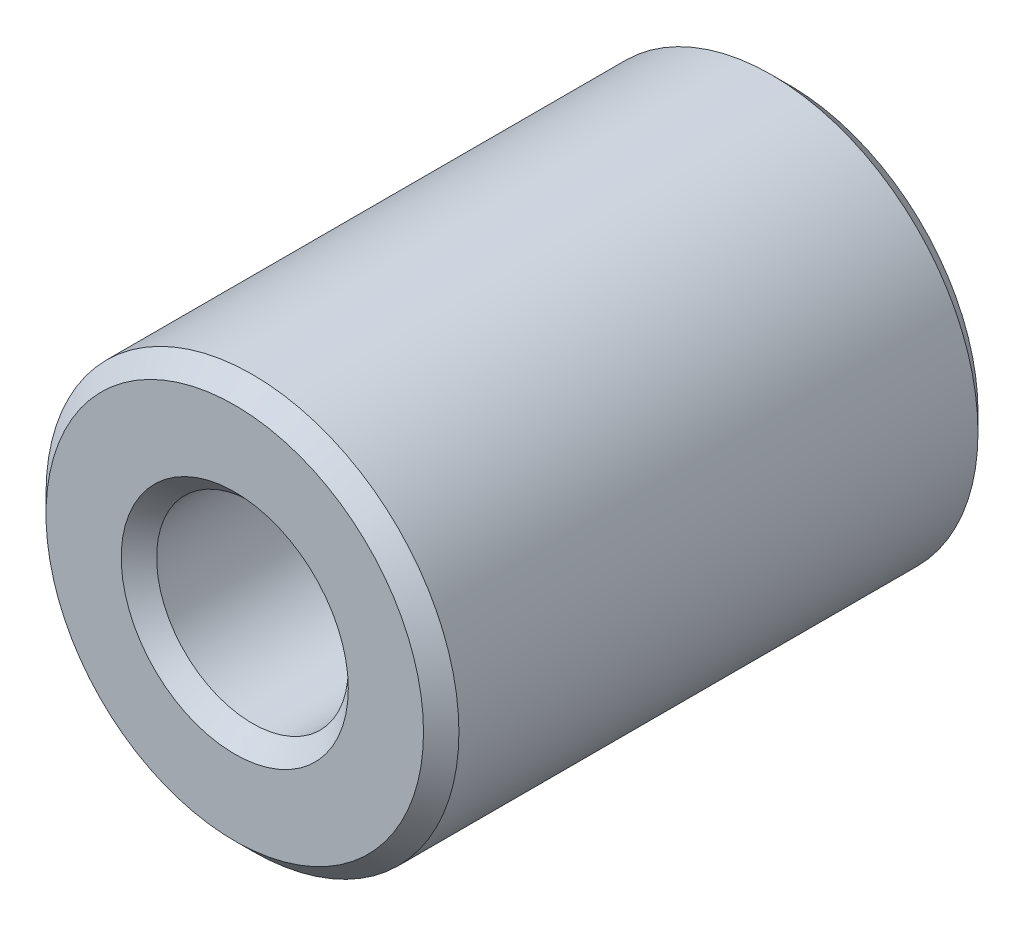
from build123d import *

# Parameters (mm, degrees)
SKETCH2_R           = 3.5
SKETCH2_R_2         = 1.625
BOSS_EXTRUDE1_DEPTH = 9.4
CHAMFER1_SIZE       = 0.3


with BuildPart() as part:
    # Sketch2 → Boss-Extrude1 (new body)
    with BuildSketch(Plane.XY):
        Circle(SKETCH2_R)
        Circle(SKETCH2_R_2, mode=Mode.SUBTRACT)
    extrude(amount=BOSS_EXTRUDE1_DEPTH)

    # Chamfer1
    chamfer1_edges = [part.edges().sort_by_distance(p)[0] for p in [
        (-3.5, 0, 0),
        (-3.5, 0, 9.4),
        (-1.625, 0, 0),
        (-1.625, 0, 9.4),
    ]]
    chamfer(chamfer1_edges, length=CHAMFER1_SIZE)


solid = part.part
